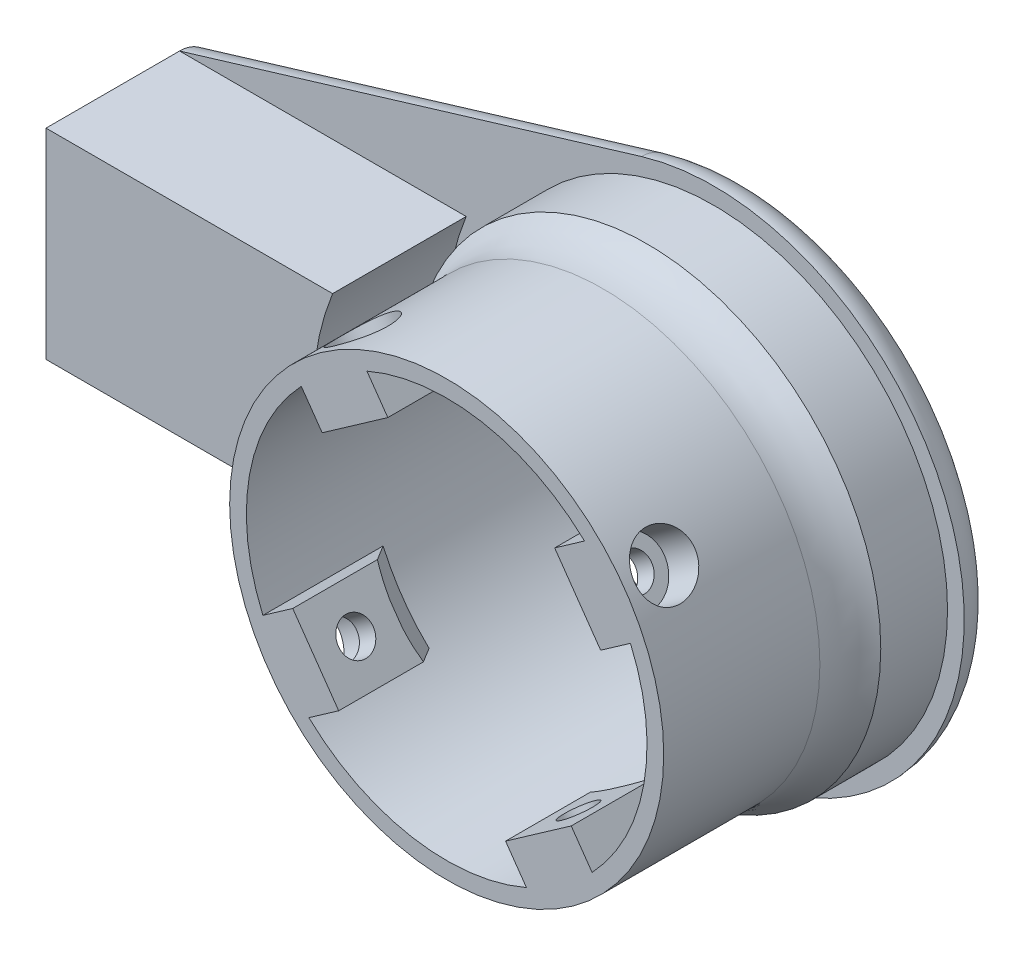
from build123d import *

# Parameters (mm, degrees)
ESQUISSE1_R                               = 30
BOSS_EXTRU_1_DEPTH                        = 5
ESQUISSE6_R                               = 35
ESQUISSE6_R_2                             = 30
BOSS_EXTRU_6_DEPTH                        = 10
ESQUISSE7_R                               = 32.5
ESQUISSE7_R_2                             = 30
BOSS_EXTRU_8_DEPTH                        = 30
CONG_2_R                                  = 10
BOSS_EXTRU_9_DEPTH                        = 20
BOSS_EXTRU_10_DEPTH                       = 12
CHANFREIN1_SIZE                           = 6
CONG_3_R                                  = 5
ENL_V_MAT_EXTRU_1_REACH                   = 93.085
ENL_V_MAT_EXTRU_1_END_RADIUS              = 32.5
ESQUISSE10_R                              = 4.5
ESQUISSE11_R                              = 4.5
ESQUISSE11_R_2                            = 2.6
BOSS_EXTRU_11_DEPTH                       = 3
R_P_TITION_CIRCULAIRE1_COUNT              = 4
CHANFREIN1_OF_R_P_TITION_CIRCULAIRE1_SIZE = 6


# Some blends are built 0.0001 mm under size
with BuildPart() as part:
    # Esquisse1 → Boss.-Extru.1 (new body)
    with BuildSketch(Plane.XY):
        with BuildLine():
            Line((-10.847469364, 35.896830061), (-80, 15))
            Line((-80, 15), (-80, -15))
            Line((-80, -15), (-10.847469364, -35.896830061))
            ThreePointArc((-10.847469364, -35.896830061), (37.5, 0), (-10.847469364, 35.896830061))
        make_face()
        Circle(ESQUISSE1_R, mode=Mode.SUBTRACT)
    extrude(amount=BOSS_EXTRU_1_DEPTH)

    # Esquisse6 → Boss.-Extru.6 (add)
    with BuildSketch(Plane.XY.offset(5)):
        Circle(ESQUISSE6_R)
        Circle(ESQUISSE6_R_2, mode=Mode.SUBTRACT)
    extrude(amount=BOSS_EXTRU_6_DEPTH)

    # Esquisse7 → Boss.-Extru.8 (add)
    with BuildSketch(Plane.XY.offset(15)):
        Circle(ESQUISSE7_R)
        Circle(ESQUISSE7_R_2, mode=Mode.SUBTRACT)
    extrude(amount=BOSS_EXTRU_8_DEPTH)

    # Congé2
    # the kernel refuses this fillet: 10 mm, written as the material it adds along each edge
    with BuildSketch(Plane(origin=(0, 0, 15), x_dir=(1, 0, 0), z_dir=(0, -1, 0))) as cong_2_piece_1:
        with BuildLine():
            CenterArc((42.5, 6.614378278), CONG_2_R, 180, 41.409622109)
            Line((32.5, 6.614378278), (32.3, 6.614378278))
            Line((32.3, 6.614378278), (32.3, 0))
            Line((32.3, 0), (32.5, -0.2))
            ThreePointArc((32.5, -0.2), (33.75, -0.2), (34.85, -0.132287566))
            Line((34.85, -0.132287566), (35, 0))
        make_face()
    revolve(axis=Axis((0, 0, 15), (0, 0, 1)))

    # Esquisse8 → Boss.-Extru.9 (add)
    with BuildSketch(Plane.XY.offset(5)):
        with BuildLine():
            Line((-80, 15), (-37.080992435, 15))
            ThreePointArc((-37.080992435, 15), (-40, 0), (-37.080992435, -15))
            Line((-37.080992435, -15), (-80, -15))
            Line((-80, -15), (-80, 15))
        make_face()
    extrude(amount=BOSS_EXTRU_9_DEPTH)

    # Esquisse9 → Boss.-Extru.10 (add)
    with BuildSketch(Plane.XY.offset(45)):
        Polygon((-29.606282822, -13.405894878), (-22.723365586, -23.235719409), (-16.170149231, -18.647107918), (-23.053066468, -8.817283387), align=None)
    boss_extru_10 = extrude(amount=-BOSS_EXTRU_10_DEPTH)

    # Chanfrein1
    # the kernel refuses this chamfer: 6 mm, written as the material it adds along each edge
    with BuildSketch(Plane(origin=(0, 0, 33), x_dir=(-0.2418024484236128, -0.9703254999928355, 0), z_dir=(0.9703254999928355, -0.2418024484236128, 0))) as chanfrein1_piece_1_section:
        Polygon((30, CHANFREIN1_SIZE), (30 - CHANFREIN1_SIZE, 0), (30, 0), align=None)
    chanfrein1_piece_1 = revolve(axis=Axis((0, 0, 33), (0, 0, -1)), revolution_arc=82.01410645, mode=Mode.PRIVATE)
    chanfrein1_piece_1 = split(chanfrein1_piece_1, bisect_by=Plane(origin=(-19.354245876, -20.876636392, 31.008979001), z_dir=(-0.573576436351043, 0.819152044288994, 0)), keep=Keep.TOP, mode=Mode.PRIVATE)
    chanfrein1_piece_1 = split(chanfrein1_piece_1, bisect_by=Plane(origin=(-26.237163113, -11.04681186, 31.008979001), z_dir=(0.5735764363510415, -0.8191520442889951, 0)), keep=Keep.TOP, mode=Mode.PRIVATE)
    chanfrein1_piece_1 = split(chanfrein1_piece_1, bisect_by=Plane(origin=(-19.611607849, -13.732195653, 31.008979001), z_dir=(-0.8191520442889946, -0.5735764363510422, 0)), keep=Keep.TOP, mode=Mode.PRIVATE)
    add(chanfrein1_piece_1)

    # Congé3
    cong_3_edges = [part.edges().sort_by_distance(p)[0] for p in [
        (37.5, 0, 0),
        (-45.423734682, 25.44841503, 0),
        (-45.423734682, -25.44841503, 0),
    ]]
    fillet(cong_3_edges, radius=CONG_3_R - 0.0001)  # a hair under: the kernel refuses the full size

    # Enlèv. mat.-Extru.1: up to this cylinder (the profile starts inside it)
    enl_v_mat_extru_1_end = Plane(origin=(0, 0, 39), z_dir=(0, 0, -1)) * Cylinder(ENL_V_MAT_EXTRU_1_END_RADIUS, 252.17, mode=Mode.PRIVATE)
    # Esquisse10 → Enlèv. mat.-Extru.1 (cut, up to the surface)
    with BuildSketch(Plane(origin=(-19.611607849, -13.732195653, 0), x_dir=(0, 0, -1), z_dir=(0.8191520442889946, 0.5735764363510424, 0)), mode=Mode.PRIVATE) as enl_v_mat_extru_1_sk1:
        with Locations(Location((-39, 0, 0), (0, 0, 90))):
            Circle(ESQUISSE10_R)
    enl_v_mat_extru_1_tool1 = extrude(enl_v_mat_extru_1_sk1.sketch, amount=-ENL_V_MAT_EXTRU_1_REACH, mode=Mode.PRIVATE) & enl_v_mat_extru_1_end
    enl_v_mat_extru_1 = enl_v_mat_extru_1_tool1.solids().sort_by_distance((-19.611608, -13.732196, 39))[0]
    add(enl_v_mat_extru_1, mode=Mode.SUBTRACT)

    # Esquisse11 → Boss.-Extru.11 (add)
    with BuildSketch(Plane(origin=(-19.611607849, -13.732195653, 0), x_dir=(0, 0, -1), z_dir=(0.8191520442889946, 0.5735764363510424, 0))):
        with Locations(Location((-39, 0, 0), (0, 0, 90))):
            Circle(ESQUISSE11_R)
        with Locations(Location((-39, 0, 0), (0, 0, 90))):
            Circle(ESQUISSE11_R_2, mode=Mode.SUBTRACT)
    boss_extru_11 = extrude(amount=-BOSS_EXTRU_11_DEPTH)

    # Répétition circulaire1: Boss.-Extru.10, Enlèv. mat.-Extru.1, Boss.-Extru.11 ×4 about axis
    r_p_tition_circulaire1_axis = Axis((0, 0, 0), (0, 0, 1))
    add([boss_extru_10.rotate(r_p_tition_circulaire1_axis, i * 360 / R_P_TITION_CIRCULAIRE1_COUNT) for i in range(1, R_P_TITION_CIRCULAIRE1_COUNT)])
    add([enl_v_mat_extru_1.rotate(r_p_tition_circulaire1_axis, i * 360 / R_P_TITION_CIRCULAIRE1_COUNT) for i in range(1, R_P_TITION_CIRCULAIRE1_COUNT)], mode=Mode.SUBTRACT)
    add([boss_extru_11.rotate(r_p_tition_circulaire1_axis, i * 360 / R_P_TITION_CIRCULAIRE1_COUNT) for i in range(1, R_P_TITION_CIRCULAIRE1_COUNT)])

    # Chanfrein1 of Répétition circulaire1
    # the kernel refuses this chamfer: 6 mm, written as the material it adds along each edge
    with BuildSketch(Plane(origin=(0, 0, 33), x_dir=(0.9703254999928355, -0.24180244842361298, 0), z_dir=(0.24180244842361298, 0.9703254999928355, 0))) as chanfrein1_of_r_p_tition_circulaire1_piece_1_section:
        Polygon((30, CHANFREIN1_OF_R_P_TITION_CIRCULAIRE1_SIZE), (30 - CHANFREIN1_OF_R_P_TITION_CIRCULAIRE1_SIZE, 0), (30, 0), align=None)
    chanfrein1_of_r_p_tition_circulaire1_piece_1 = revolve(axis=Axis((0, 0, 33), (0, 0, -1)), revolution_arc=82.01410645, mode=Mode.PRIVATE)
    chanfrein1_of_r_p_tition_circulaire1_piece_1 = split(chanfrein1_of_r_p_tition_circulaire1_piece_1, bisect_by=Plane(origin=(20.876636392, -19.354245876, 31.008979001), z_dir=(-0.8191520442889941, -0.5735764363510429, 0)), keep=Keep.TOP, mode=Mode.PRIVATE)
    chanfrein1_of_r_p_tition_circulaire1_piece_1 = split(chanfrein1_of_r_p_tition_circulaire1_piece_1, bisect_by=Plane(origin=(11.04681186, -26.237163113, 31.008979001), z_dir=(0.8191520442889952, 0.5735764363510414, 0)), keep=Keep.TOP, mode=Mode.PRIVATE)
    chanfrein1_of_r_p_tition_circulaire1_piece_1 = split(chanfrein1_of_r_p_tition_circulaire1_piece_1, bisect_by=Plane(origin=(13.732195653, -19.611607849, 31.008979001), z_dir=(0.573576436351042, -0.8191520442889947, 0)), keep=Keep.TOP, mode=Mode.PRIVATE)
    add(chanfrein1_of_r_p_tition_circulaire1_piece_1)
    with BuildSketch(Plane(origin=(0, 0, 33), x_dir=(0.24180244842361312, 0.9703254999928353, 0), z_dir=(-0.9703254999928353, 0.24180244842361312, 0))) as chanfrein1_of_r_p_tition_circulaire1_piece_2_section:
        Polygon((30, CHANFREIN1_OF_R_P_TITION_CIRCULAIRE1_SIZE), (30 - CHANFREIN1_OF_R_P_TITION_CIRCULAIRE1_SIZE, 0), (30, 0), align=None)
    chanfrein1_of_r_p_tition_circulaire1_piece_2 = revolve(axis=Axis((0, 0, 33), (0, 0, -1)), revolution_arc=82.01410645, mode=Mode.PRIVATE)
    chanfrein1_of_r_p_tition_circulaire1_piece_2 = split(chanfrein1_of_r_p_tition_circulaire1_piece_2, bisect_by=Plane(origin=(19.354245876, 20.876636392, 31.008979001), z_dir=(0.5735764363510429, -0.8191520442889941, 0)), keep=Keep.TOP, mode=Mode.PRIVATE)
    chanfrein1_of_r_p_tition_circulaire1_piece_2 = split(chanfrein1_of_r_p_tition_circulaire1_piece_2, bisect_by=Plane(origin=(26.237163113, 11.04681186, 31.008979001), z_dir=(-0.5735764363510414, 0.8191520442889952, 0)), keep=Keep.TOP, mode=Mode.PRIVATE)
    chanfrein1_of_r_p_tition_circulaire1_piece_2 = split(chanfrein1_of_r_p_tition_circulaire1_piece_2, bisect_by=Plane(origin=(19.611607849, 13.732195653, 31.008979001), z_dir=(0.8191520442889947, 0.573576436351042, 0)), keep=Keep.TOP, mode=Mode.PRIVATE)
    add(chanfrein1_of_r_p_tition_circulaire1_piece_2)
    with BuildSketch(Plane(origin=(0, 0, 33), x_dir=(-0.9703254999928356, 0.24180244842361232, 0), z_dir=(-0.24180244842361232, -0.9703254999928356, 0))) as chanfrein1_of_r_p_tition_circulaire1_piece_3_section:
        Polygon((30, CHANFREIN1_OF_R_P_TITION_CIRCULAIRE1_SIZE), (30 - CHANFREIN1_OF_R_P_TITION_CIRCULAIRE1_SIZE, 0), (30, 0), align=None)
    chanfrein1_of_r_p_tition_circulaire1_piece_3 = revolve(axis=Axis((0, 0, 33), (0, 0, -1)), revolution_arc=82.01410645, mode=Mode.PRIVATE)
    chanfrein1_of_r_p_tition_circulaire1_piece_3 = split(chanfrein1_of_r_p_tition_circulaire1_piece_3, bisect_by=Plane(origin=(-20.876636392, 19.354245876, 31.008979001), z_dir=(0.8191520442889941, 0.5735764363510428, 0)), keep=Keep.TOP, mode=Mode.PRIVATE)
    chanfrein1_of_r_p_tition_circulaire1_piece_3 = split(chanfrein1_of_r_p_tition_circulaire1_piece_3, bisect_by=Plane(origin=(-11.04681186, 26.237163113, 31.008979001), z_dir=(-0.8191520442889952, -0.5735764363510413, 0)), keep=Keep.TOP, mode=Mode.PRIVATE)
    chanfrein1_of_r_p_tition_circulaire1_piece_3 = split(chanfrein1_of_r_p_tition_circulaire1_piece_3, bisect_by=Plane(origin=(-13.732195653, 19.611607849, 31.008979001), z_dir=(-0.5735764363510419, 0.8191520442889947, 0)), keep=Keep.TOP, mode=Mode.PRIVATE)
    add(chanfrein1_of_r_p_tition_circulaire1_piece_3)


solid = part.part
